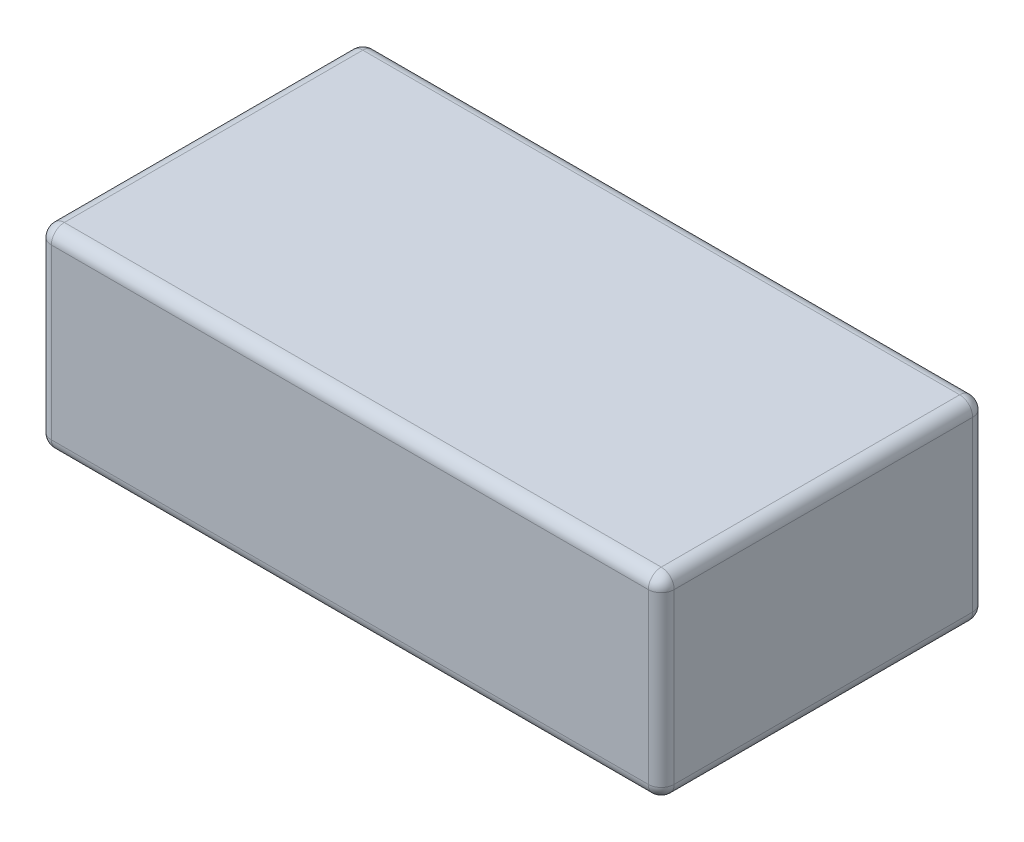
from build123d import *

# Parameters (mm, degrees)
SKETCH1_W           = 48
SKETCH1_H           = 25
BOSS_EXTRUDE1_DEPTH = 15
FILLET1_R           = 1


with BuildPart() as part:
    # Sketch1 → Boss-Extrude1 (new body)
    with BuildSketch(Plane(origin=(0, 0, 0), x_dir=(1, 0, 0), z_dir=(0, 1, 0))):
        Rectangle(SKETCH1_W, SKETCH1_H)
    extrude(amount=BOSS_EXTRUDE1_DEPTH)

    # Fillet1
    fillet1_edges = [part.edges().sort_by_distance(p)[0] for p in [
        (24, 0, 0),
        (0, 0, -12.5),
        (-24, 0, 0),
        (0, 0, 12.5),
        (24, 15, 0),
        (0, 15, -12.5),
        (-24, 15, 0),
        (0, 15, 12.5),
        (24, 7.5, 12.5),
        (-24, 7.5, 12.5),
        (24, 7.5, -12.5),
        (-24, 7.5, -12.5),
    ]]
    fillet(fillet1_edges, radius=FILLET1_R)


solid = part.part
